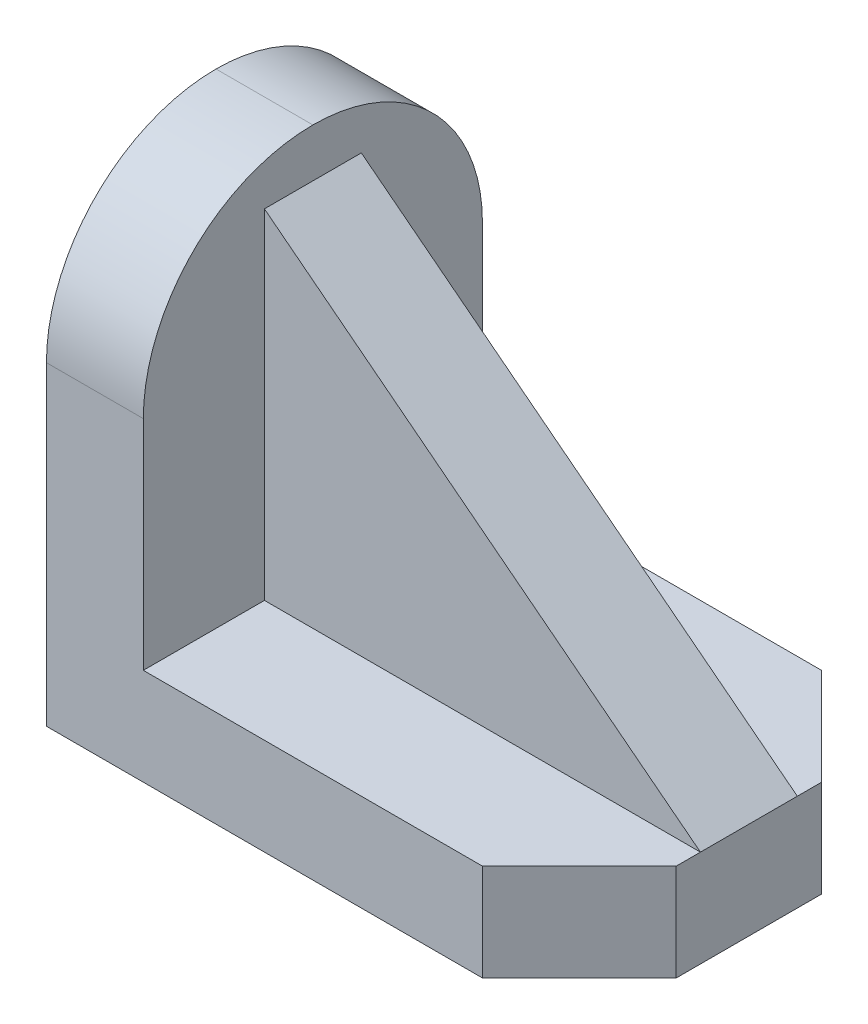
from build123d import *

# Parameters (mm, degrees)
BOSS_EXTRUDE1_DEPTH = 30.48
BOSS_EXTRUDE2_DEPTH = 121.92
SKETCH2_3_W         = 137.16
SKETCH2_3_H         = 30.48
BOSS_EXTRUDE3_DEPTH = 106.68
FILLET1_R           = 53.34
CHAMFER1_SIZE2      = 137.16
CHAMFER1_SIZE       = 106.68


with BuildPart() as part:
    # Sketch1 → Boss-Extrude1 (new body)
    with BuildSketch(Plane(origin=(0, 0, 0), x_dir=(1, 0, 0), z_dir=(0, 1, 0))):
        Polygon((0, 0), (137.16, 0), (167.64, 30.48), (167.64, 76.2), (137.16, 106.68), (0, 106.68), align=None)
    extrude(amount=BOSS_EXTRUDE1_DEPTH)

    # Sketch2 → Boss-Extrude2 (add)
    with BuildSketch(Plane(origin=(0, 30.48, 0), x_dir=(1, 0, 0), z_dir=(0, 1, 0))):
        Polygon((30.48, 106.68), (0, 106.68), (0, 0), (30.48, 0), (30.48, 38.1), (30.48, 68.58), align=None)
    extrude(amount=BOSS_EXTRUDE2_DEPTH)

    # Sketch2<3> → Boss-Extrude3 (add)
    with BuildSketch(Plane(origin=(0, 30.48, 0), x_dir=(1, 0, 0), z_dir=(0, 1, 0))):
        with Locations((99.06, 53.34)):
            Rectangle(SKETCH2_3_W, SKETCH2_3_H)
    extrude(amount=BOSS_EXTRUDE3_DEPTH)

    # Fillet1
    fillet1_edges = [part.edges().sort_by_distance(p)[0] for p in [
        (15.24, 152.4, 0),
        (15.24, 152.4, -106.68),
    ]]
    fillet(fillet1_edges, radius=FILLET1_R - 0.0001)  # a hair under: the kernel refuses the full size

    # Chamfer1
    chamfer1_edges = [part.edges().sort_by_distance(p)[0] for p in [
        (167.64, 137.16, -53.34),
    ]]
    chamfer1_side = [part.faces().sort_by_distance(p)[0] for p in [
        (167.64, 135.0264, -53.34),
    ]]
    chamfer(chamfer1_edges, length=CHAMFER1_SIZE - 0.0001, length2=CHAMFER1_SIZE2 - 0.0001, reference=chamfer1_side[0])  # a hair under: the kernel refuses the full size


solid = part.part
